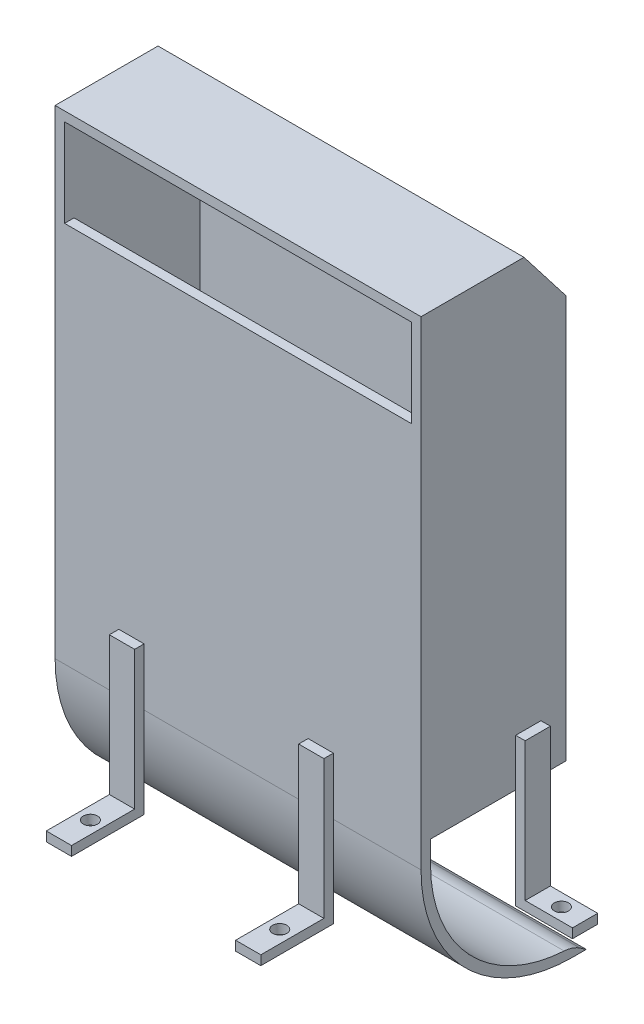
from build123d import *

# Parameters (mm, degrees)
BOSS_EXTRUDE1_DEPTH      = 116
SKETCH2_W                = 3
SKETCH2_H                = 114.039132923
BOSS_EXTRUDE2_DEPTH      = 40
SKETCH3_W                = 116
SKETCH3_H                = 114.039132923
BOSS_EXTRUDE3_DEPTH      = 3
BOSS_EXTRUDE4_DEPTH      = 116
BOSS_EXTRUDE5_DEPTH      = 3
BOSS_EXTRUDE6_DEPTH      = 3
FILLET6_R                = 10
BOSS_EXTRUDE7_DEPTH      = 31.86
BOSS_EXTRUDE7_DEPTH_BACK = 15
SKETCH8_W                = 3
SKETCH8_H                = 8
SKETCH8_W_2              = 8
SKETCH8_H_2              = 3
SKETCH9_W                = 8
SKETCH9_H                = 3
BOSS_EXTRUDE8_DEPTH      = 15
SKETCH10_W               = 8
SKETCH10_H               = 3
BOSS_EXTRUDE9_DEPTH      = 15
SKETCH11_R               = 2.25
CUT_EXTRUDE1_DEPTH       = 15
SKETCH12_W               = 8
SKETCH12_H               = 3
BOSS_EXTRUDE10_DEPTH     = 20
SKETCH13_R               = 2.25
CUT_EXTRUDE2_DEPTH       = 20


with BuildPart() as part:
    # Sketch1 → Boss-Extrude1 (new body)
    with BuildSketch(Plane(origin=(0, 0, 0), x_dir=(0, 0, -1), z_dir=(1, 0, 0))):
        with BuildLine():
            Line((0, 0), (0, 121))
            Line((0, 121), (3, 121))
            Line((3, 121), (3, 0))
            ThreePointArc((3, 0), (16.180194847, -31.819805153), (48, -45))
            Line((48, -45), (52.371478475, -48))
            Line((52.371478475, -48), (48, -48))
            ThreePointArc((48, -48), (14.058874503, -33.941125497), (0, 0))
        make_face()
    extrude(amount=BOSS_EXTRUDE1_DEPTH)

    # Sketch2 → Boss-Extrude2 (add)
    with BuildSketch(Plane(origin=(0, 0, -3), x_dir=(-1, 0, 0), z_dir=(0, 0, -1))):
        with Locations((-114.5, 63.980433539)):
            Rectangle(SKETCH2_W, SKETCH2_H)
        with Locations((-1.5, 63.980433539)):
            Rectangle(SKETCH2_W, SKETCH2_H)
    extrude(amount=BOSS_EXTRUDE2_DEPTH)

    # Sketch3 → Boss-Extrude3 (add)
    with BuildSketch(Plane(origin=(0, 0, -43), x_dir=(-1, 0, 0), z_dir=(0, 0, -1))):
        with Locations((-58, 63.980433539)):
            Rectangle(SKETCH3_W, SKETCH3_H)
    extrude(amount=BOSS_EXTRUDE3_DEPTH)

    # Sketch5 → Boss-Extrude4 (add)
    with BuildSketch(Plane(origin=(116, 0, 0), x_dir=(0, 0, -1), z_dir=(1, 0, 0))):
        Polygon((43, 134.156044254), (31.604756539, 148.876206484), (0, 148.876206484), (0, 151.876206484), (32.622140303, 151.876206484), (46, 134.594937707), (46, 121), (43, 121), align=None)
    extrude(amount=-BOSS_EXTRUDE4_DEPTH)

    # Sketch6 → Boss-Extrude5 (add)
    with BuildSketch(Plane(origin=(116, 0, 0), x_dir=(0, 0, -1), z_dir=(1, 0, 0))):
        Polygon((0, 148.876206484), (31.604756539, 148.876206484), (43, 134.156044254), (43, 121), (0, 121), align=None)
    extrude(amount=-BOSS_EXTRUDE5_DEPTH)

    # Sketch7 → Boss-Extrude6 (add)
    with BuildSketch(Plane.ZY):
        Polygon((-31.604756539, 148.876206484), (0, 148.876206484), (0, 121), (-43, 121), (-43, 134.156044254), align=None)
    extrude(amount=-BOSS_EXTRUDE6_DEPTH)

    # Fillet6
    fillet6_edges = [part.edges().sort_by_distance(p)[0] for p in [
        (58, -45, -48),
    ]]
    fillet(fillet6_edges, radius=FILLET6_R)

    # Sketch8 → Boss-Extrude7 (add, two sides: drawn at the far end of the back side and taken through both)
    with BuildSketch(Plane.XZ.offset(-6.960867077).offset(-BOSS_EXTRUDE7_DEPTH_BACK)):
        with Locations((-1.5, -34)):
            Rectangle(SKETCH8_W, SKETCH8_H)
        with Locations((117.5, -34)):
            Rectangle(SKETCH8_W, SKETCH8_H)
        with Locations((88, 5.294790491)):
            Rectangle(SKETCH8_W_2, SKETCH8_H_2)
        with Locations((28, 5.294790491)):
            Rectangle(SKETCH8_W_2, SKETCH8_H_2)
    extrude(amount=BOSS_EXTRUDE7_DEPTH + BOSS_EXTRUDE7_DEPTH_BACK)


with BuildPart() as boss_extrude7_piece_1:
    # of the separate pieces the step leaves, piece 1, a body of its own (boss_extrude7_pieces)
    add(part.part.solids().sort_by_distance((116, -44.921825134, -45.34865569))[0])

    # Sketch9 → Boss-Extrude8 (add)
    with BuildSketch(Plane.ZY.offset(3)):
        with Locations((-34, -23.399132923)):
            Rectangle(SKETCH9_W, SKETCH9_H)
    extrude(amount=BOSS_EXTRUDE8_DEPTH)

    # Sketch10 → Boss-Extrude9 (add)
    with BuildSketch(Plane(origin=(119, 0, 0), x_dir=(0, 0, -1), z_dir=(1, 0, 0))):
        with Locations((34, -23.399132923)):
            Rectangle(SKETCH10_W, SKETCH10_H)
    extrude(amount=BOSS_EXTRUDE9_DEPTH)

    # Sketch11 → Cut-Extrude1 (cut)
    with BuildSketch(Plane(origin=(0, -21.899132923, 0), x_dir=(1, 0, 0), z_dir=(0, 1, 0))):
        with Locations((126.5, 34)):
            Circle(SKETCH11_R)
        with Locations((-10.5, 33.632540973)):
            Circle(SKETCH11_R)
    extrude(amount=-CUT_EXTRUDE1_DEPTH, mode=Mode.SUBTRACT)


with BuildPart() as boss_extrude7_piece_2:
    # of the separate pieces the step leaves, piece 2, a body of its own (boss_extrude7_pieces)
    add(part.part.solids().sort_by_distance((92, -24.899132923, 3.794790491))[0])



with BuildPart() as boss_extrude7_piece_3:
    # of the separate pieces the step leaves, piece 3, a body of its own (boss_extrude7_pieces)
    add(part.part.solids().sort_by_distance((32, -24.899132923, 3.794790491))[0])


with BuildPart() as boss_extrude7_piece_2_1:
    add(boss_extrude7_piece_2.part)

    add(boss_extrude7_piece_3.part)  # Boss-Extrude10 merges Boss-Extrude7 piece 3
    # Sketch12 → Boss-Extrude10 (add)
    with BuildSketch(Plane.XY.offset(6.794790491)):
        with Locations((28, -23.399132923)):
            Rectangle(SKETCH12_W, SKETCH12_H)
        with Locations((88, -23.399132923)):
            Rectangle(SKETCH12_W, SKETCH12_H)
    extrude(amount=BOSS_EXTRUDE10_DEPTH)

    # Sketch13 → Cut-Extrude2 (cut)
    with BuildSketch(Plane(origin=(0, -21.899132923, 0), x_dir=(1, 0, 0), z_dir=(0, 1, 0))):
        with Locations((28, -16.794790491)):
            Circle(SKETCH13_R)
        with Locations((88, -16.794790491)):
            Circle(SKETCH13_R)
    extrude(amount=-CUT_EXTRUDE2_DEPTH, mode=Mode.SUBTRACT)


solid = Compound([boss_extrude7_piece_1.part, boss_extrude7_piece_2_1.part])
